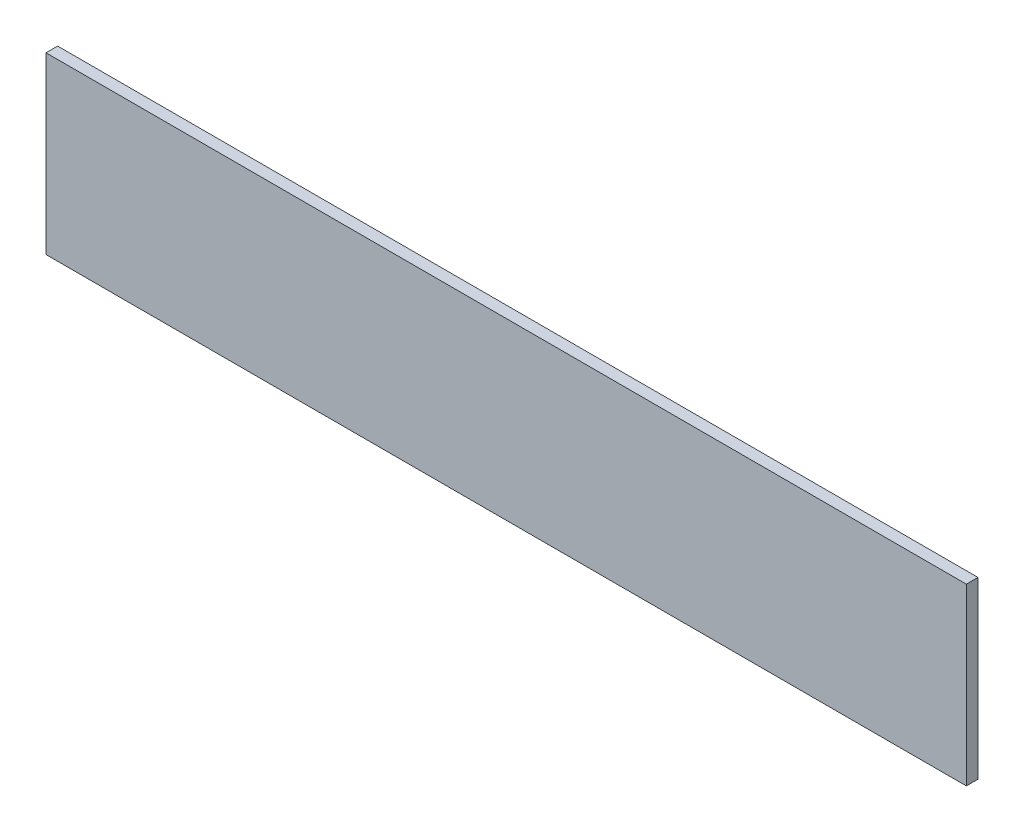
from build123d import *

# Parameters (mm, degrees)
SKIZZE1_W                       = 790
SKIZZE1_H                       = 150
AUFSATZ_LINEAR_AUSTRAGEN1_DEPTH = 10


with BuildPart() as part:
    # Skizze1 → Aufsatz-Linear austragen1 (new body)
    with BuildSketch(Plane.XY):
        Rectangle(SKIZZE1_W, SKIZZE1_H)
    extrude(amount=AUFSATZ_LINEAR_AUSTRAGEN1_DEPTH)


solid = part.part
